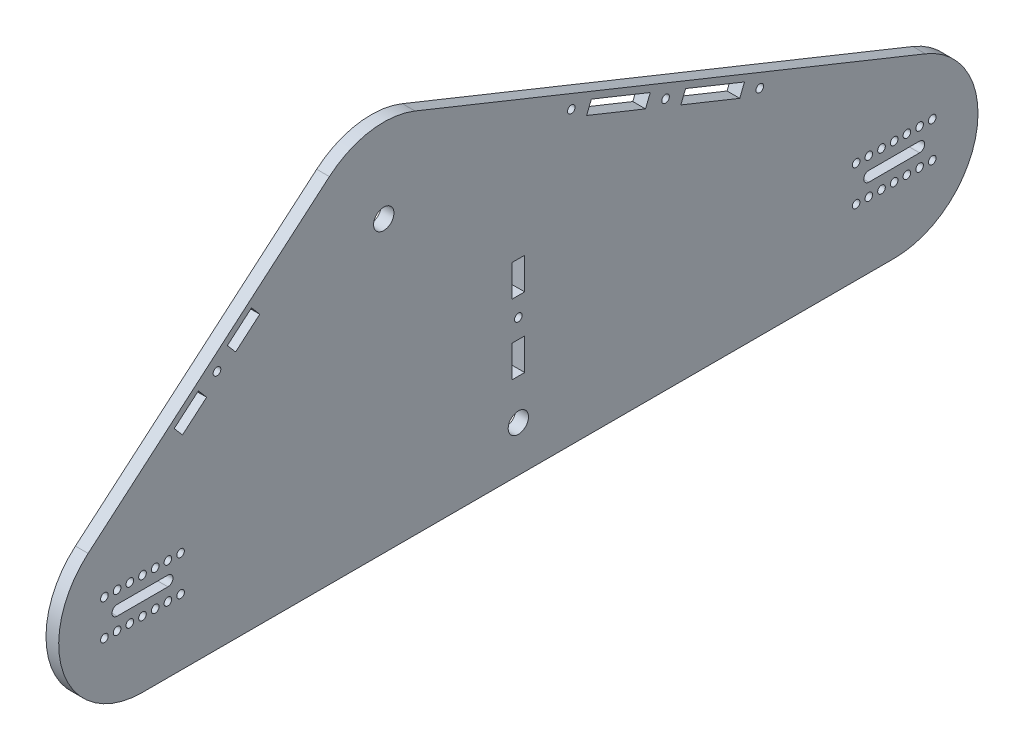
from build123d import *

# Parameters (mm, degrees)
SCHIZZO3_R                   = 1.5
ESTRUSIONE_ESTRUSIONE1_DEPTH = 5
SCHIZZO2_R                   = 2
SCHIZZO2_R_2                 = 4
TAGLIO_ESTRUSIONE1_DEPTH     = 261.340162096
TAGLIO_ESTRUSIONE2_DEPTH     = 261.340162096
SCHIZZO6_R                   = 1.5
SCHIZZO6_R_2                 = 4
SCHIZZO6_W                   = 5
SCHIZZO6_H                   = 12.5
TAGLIO_ESTRUSIONE4_DEPTH     = 261.340162096


with BuildPart() as part:
    # Schizzo3 → Estrusione-Estrusione1 (new body)
    with BuildSketch(Plane(origin=(0, 0, 0), x_dir=(0, 0, -1), z_dir=(1, 0, 0))):
        with BuildLine():
            Line((-95, -33), (201, -33))
            ThreePointArc((201, -33), (233.396512744, -6.282194046), (213.334616938, 30.608123513))
            Line((213.334616938, 30.608123513), (12.334616938, 111.608123513))
            ThreePointArc((12.334616938, 111.608123513), (-5.305430843, 113.570729245), (-21.410737295, 106.111358555))
            Line((-21.410737295, 106.111358555), (-116.410737295, 25.111358555))
            ThreePointArc((-116.410737295, 25.111358555), (-125.96509997, -11.408881796), (-95, -33))
        make_face()
        with Locations((-65.666686189, 61.806607259)):
            Circle(SCHIZZO3_R, mode=Mode.SUBTRACT)
        with Locations((110.965735584, 66.470529041)):
            Circle(SCHIZZO3_R, mode=Mode.SUBTRACT)
        with Locations((73.86497981, 81.421579875)):
            Circle(SCHIZZO3_R, mode=Mode.SUBTRACT)
        with Locations((148.066491357, 51.519478207)):
            Circle(SCHIZZO3_R, mode=Mode.SUBTRACT)
    extrude(amount=ESTRUSIONE_ESTRUSIONE1_DEPTH)

    # Schizzo2 → Taglio-Estrusione1 (cut, through all)
    with BuildSketch(Plane(origin=(0, 0, 0), x_dir=(0, 0, -1), z_dir=(1, 0, 0))):
        with Locations((-95, 0)):
            Circle(SCHIZZO2_R)
        with Locations((201, 0)):
            Circle(SCHIZZO2_R)
        with Locations((0, 81)):
            Circle(SCHIZZO2_R_2)
    extrude(amount=TAGLIO_ESTRUSIONE1_DEPTH, mode=Mode.SUBTRACT)

    # Schizzo4 → Taglio-Estrusione2 (cut, through all)
    with BuildSketch(Plane(origin=(0, 0, 0), x_dir=(0, 0, -1), z_dir=(1, 0, 0))):
        Polygon((104.943784553, 71.592648309), (103.074903199, 66.955053837), (79.886930841, 76.299460608), (81.755812195, 80.93705508), align=None)
        Polygon((118.856567968, 65.986004246), (116.987686614, 61.348409774), (140.175658973, 52.004003003), (142.044540327, 56.641597475), align=None)
        Polygon((-82.507716927, 50.732778486), (-72.995838686, 58.842906249), (-69.751787581, 55.038154953), (-79.263665822, 46.92802719), align=None)
        Polygon((-61.581584798, 68.575059565), (-58.337533692, 64.770308269), (-48.825655452, 72.880436032), (-52.069706557, 76.685187328), align=None)
    extrude(amount=TAGLIO_ESTRUSIONE2_DEPTH, mode=Mode.SUBTRACT)

    # Schizzo6 → Taglio-Estrusione4 (cut, through all)
    with BuildSketch(Plane(origin=(0, 0, 0), x_dir=(0, 0, -1), z_dir=(1, 0, 0))):
        with Locations((-95, 7)):
            Circle(SCHIZZO6_R)
        with Locations((-90, 7)):
            Circle(SCHIZZO6_R)
        with Locations((-85, 7)):
            Circle(SCHIZZO6_R)
        with Locations((-80, 7)):
            Circle(SCHIZZO6_R)
        with Locations((53, -15)):
            Circle(SCHIZZO6_R_2)
        with Locations((53, 20.84)):
            Circle(SCHIZZO6_R)
        with Locations((-100, 7)):
            Circle(SCHIZZO6_R)
        with Locations((-105, 7)):
            Circle(SCHIZZO6_R)
        with Locations((-110, 7)):
            Circle(SCHIZZO6_R)
        with Locations((-80, -7)):
            Circle(SCHIZZO6_R)
        with Locations((-85, -7)):
            Circle(SCHIZZO6_R)
        with Locations((-90, -7)):
            Circle(SCHIZZO6_R)
        with Locations((-95, -7)):
            Circle(SCHIZZO6_R)
        with Locations((-100, -7)):
            Circle(SCHIZZO6_R)
        with Locations((-105, -7)):
            Circle(SCHIZZO6_R)
        with Locations((-110, -7)):
            Circle(SCHIZZO6_R)
        with Locations((216, -7)):
            Circle(SCHIZZO6_R)
        with Locations((211, -7)):
            Circle(SCHIZZO6_R)
        with Locations((206, -7)):
            Circle(SCHIZZO6_R)
        with Locations((201, -7)):
            Circle(SCHIZZO6_R)
        with Locations((196, -7)):
            Circle(SCHIZZO6_R)
        with Locations((191, -7)):
            Circle(SCHIZZO6_R)
        with Locations((186, -7)):
            Circle(SCHIZZO6_R)
        with Locations((186, 7)):
            Circle(SCHIZZO6_R)
        with Locations((191, 7)):
            Circle(SCHIZZO6_R)
        with Locations((196, 7)):
            Circle(SCHIZZO6_R)
        with Locations((201, 7)):
            Circle(SCHIZZO6_R)
        with Locations((206, 7)):
            Circle(SCHIZZO6_R)
        with Locations((211, 7)):
            Circle(SCHIZZO6_R)
        with Locations((216, 7)):
            Circle(SCHIZZO6_R)
        with BuildLine():
            Line((-105, 2), (-85, 2))
            ThreePointArc((-85, 2), (-83, 0), (-85, -2))
            Line((-85, -2), (-105, -2))
            ThreePointArc((-105, -2), (-107, 0), (-105, 2))
        make_face()
        with BuildLine():
            Line((191, 2), (211, 2))
            ThreePointArc((211, 2), (213, 0), (211, -2))
            Line((211, -2), (191, -2))
            ThreePointArc((191, -2), (189, 0), (191, 2))
        make_face()
        with Locations((53, 34.59)):
            Rectangle(SCHIZZO6_W, SCHIZZO6_H)
        with Locations((53, 7.09)):
            Rectangle(SCHIZZO6_W, SCHIZZO6_H)
    extrude(amount=TAGLIO_ESTRUSIONE4_DEPTH, mode=Mode.SUBTRACT)


solid = part.part
